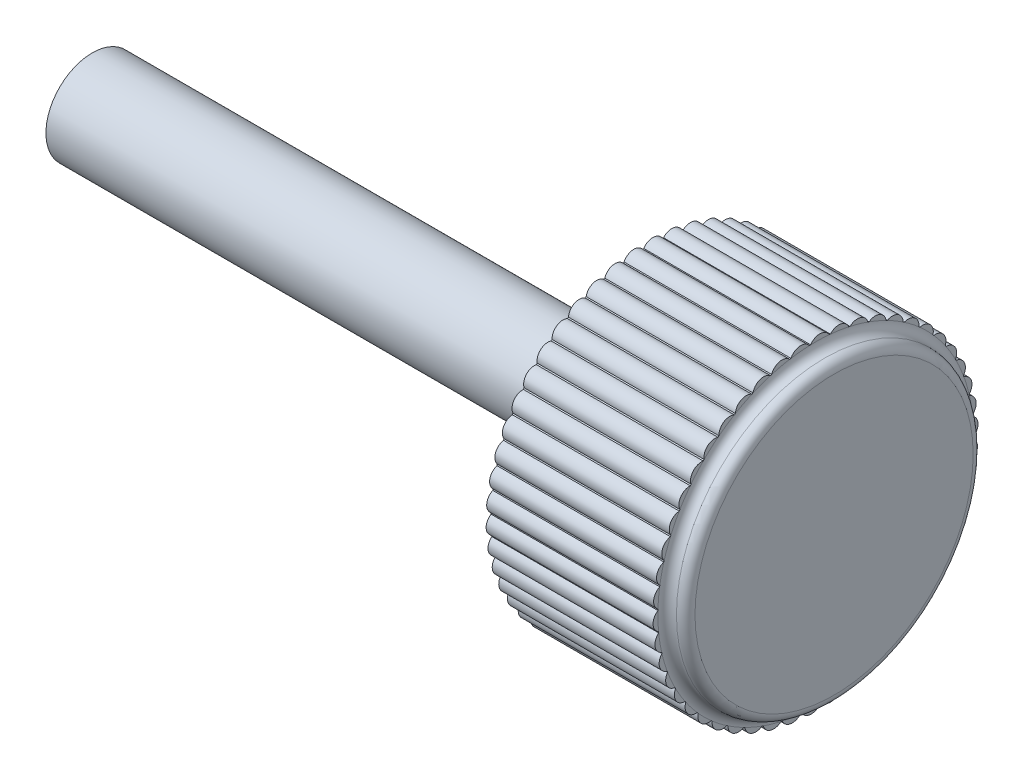
from build123d import *

# Parameters (mm, degrees)
SKETCH1_R      = 0.635
EXTRUDE1_DEPTH = 7.62
SKETCH2_R      = 2.032
EXTRUDE2_DEPTH = 2.54
EXTRUDE6_DEPTH = 2.286
FILLET2_R      = 0.127


with BuildPart() as part:
    # Sketch1 → Extrude1 (new body)
    with BuildSketch(Plane(origin=(0, 0, 0), x_dir=(0, 0, -1), z_dir=(1, 0, 0))):
        Circle(SKETCH1_R)
    extrude(amount=EXTRUDE1_DEPTH)

    # Sketch2 → Extrude2 (add)
    with BuildSketch(Plane(origin=(7.62, 0, 0), x_dir=(0, 0, -1), z_dir=(1, 0, 0))):
        Circle(SKETCH2_R)
    extrude(amount=EXTRUDE2_DEPTH)

    # Sketch3 → Extrude6 (add)
    with BuildSketch(Plane(origin=(9.906, 0, 0), x_dir=(0, 0, -1), z_dir=(1, 0, 0))):
        with BuildLine():
            ThreePointArc((-1.857711232, 1.100086351), (-1.862029707, 1.092760893), (-1.866319297, 1.085418482))
            ThreePointArc((-1.866319297, 1.085418482), (-1.987323102, 1.004182608), (-1.980940003, 0.858578886))
            ThreePointArc((-1.980940003, 0.858578886), (-1.984306303, 0.850769943), (-1.98764182, 0.842947801))
            ThreePointArc((-1.98764182, 0.842947801), (-2.097509919, 0.747186698), (-2.072928168, 0.603531119))
            ThreePointArc((-2.072928168, 0.603531119), (-2.075289203, 0.595361842), (-2.077618044, 0.587183329))
            ThreePointArc((-2.077618044, 0.587183329), (-2.174617752, 0.478407207), (-2.132225017, 0.338965306))
            ThreePointArc((-2.132225017, 0.338965306), (-2.133543553, 0.33056453), (-2.134828991, 0.322158626))
            ThreePointArc((-2.134828991, 0.322158626), (-2.217430563, 0.202082949), (-2.157895403, 0.069053807))
            ThreePointArc((-2.157895403, 0.069053807), (-2.158150646, 0.060554017), (-2.158372409, 0.052053288))
            ThreePointArc((-2.158372409, 0.052053288), (-2.22527317, -0.077428278), (-2.14953449, -0.201946712))
            ThreePointArc((-2.14953449, -0.201946712), (-2.148722414, -0.210411468), (-2.147877005, -0.218872961))
            ThreePointArc((-2.147877005, -0.218872961), (-2.19802189, -0.355718415), (-2.107274135, -0.46976241))
            ThreePointArc((-2.107274135, -0.46976241), (-2.105407547, -0.478058639), (-2.103508297, -0.486347452))
            ThreePointArc((-2.103508297, -0.486347452), (-2.136106492, -0.62839866), (-2.031780807, -0.730169674))
            ThreePointArc((-2.031780807, -0.730169674), (-2.028889144, -0.73816654), (-2.025966007, -0.746151954))
            ThreePointArc((-2.025966007, -0.746151954), (-2.040503418, -0.891168683), (-1.924245082, -0.979061727))
            ThreePointArc((-1.924245082, -0.979061727), (-1.920373948, -0.986633113), (-1.916473023, -0.994189194))
            ThreePointArc((-1.916473023, -0.994189194), (-1.912720387, -1.139884443), (-1.786362863, -1.212513391))
            ThreePointArc((-1.786362863, -1.212513391), (-1.781573307, -1.219539893), (-1.776756114, -1.226547476))
            ThreePointArc((-1.776756114, -1.226547476), (-1.754772612, -1.370623545), (-1.620308634, -1.426842994))
            ThreePointArc((-1.620308634, -1.426842994), (-1.614676191, -1.4332138), (-1.6090187, -1.439562372))
            ThreePointArc((-1.6090187, -1.439562372), (-1.569151025, -1.579747094), (-1.42870117, -1.618670432))
            ThreePointArc((-1.42870117, -1.618670432), (-1.422314667, -1.624285069), (-1.4159061, -1.629874509))
            ThreePointArc((-1.4159061, -1.629874509), (-1.358782989, -1.763957089), (-1.214562235, -1.784970469))
            ThreePointArc((-1.214562235, -1.784970469), (-1.207522392, -1.789740393), (-1.200463815, -1.794482552))
            ThreePointArc((-1.200463815, -1.794482552), (-1.126986133, -1.920348426), (-0.981268929, -1.923120456))
            ThreePointArc((-0.981268929, -1.923120456), (-0.973686766, -1.926970441), (-0.966089499, -1.930790533))
            ThreePointArc((-0.966089499, -1.930790533), (-0.877416033, -2.046454721), (-0.732500425, -2.030941685))
            ThreePointArc((-0.732500425, -2.030941685), (-0.724495519, -2.033811015), (-0.716479374, -2.036648793))
            ThreePointArc((-0.716479374, -2.036648793), (-0.614008558, -2.140287203), (-0.472179951, -2.10673375))
            ThreePointArc((-0.472179951, -2.10673375), (-0.463878544, -2.108577173), (-0.455569941, -2.110387886))
            ThreePointArc((-0.455569941, -2.110387886), (-0.340917802, -2.200366077), (-0.204412918, -2.149301365))
            ThreePointArc((-0.204412918, -2.149301365), (-0.195945928, -2.150089811), (-0.187475898, -2.150844901))
            ThreePointArc((-0.187475898, -2.150844901), (-0.062450567, -2.225743864), (0.066577829, -2.157973214))
            ThreePointArc((0.066577829, -2.157973214), (0.075076873, -2.157694247), (0.083574752, -2.157381807))
            ThreePointArc((0.083574752, -2.157381807), (0.21700155, -2.21602034), (0.336518603, -2.132612536))
            ThreePointArc((0.336518603, -2.132612536), (0.344915666, -2.131270556), (0.353307378, -2.129895513))
            ThreePointArc((0.353307378, -2.129895513), (0.493031422, -2.171348852), (0.601152279, -2.073619285))
            ThreePointArc((0.601152279, -2.073619285), (0.609314933, -2.071235455), (0.617468135, -2.068819495))
            ThreePointArc((0.617468135, -2.068819495), (0.761285895, -2.092433895), (0.856305424, -1.981923818))
            ThreePointArc((0.856305424, -1.981923818), (0.86410494, -1.978535734), (0.871891052, -1.975116957))
            ThreePointArc((0.871891052, -1.975116957), (1.017534435, -1.980520006), (1.09795412, -1.858972229))
            ThreePointArc((1.09795412, -1.858972229), (1.105267496, -1.854633323), (1.112563725, -1.850265645))
            ThreePointArc((1.112563725, -1.850265645), (1.257735848, -1.837372134), (1.322287425, -1.706703538))
            ThreePointArc((1.322287425, -1.706703538), (1.328999323, -1.701482236), (1.335690604, -1.696234539))
            ThreePointArc((1.335690604, -1.696234539), (1.478102016, -1.665247805), (1.525767467, -1.527519112))
            ThreePointArc((1.525767467, -1.527519112), (1.531772037, -1.521497758), (1.537752844, -1.5154528))
            ThreePointArc((1.537752844, -1.5154528), (1.675157632, -1.466861523), (1.705185244, -1.324244797))
            ThreePointArc((1.705185244, -1.324244797), (1.710387791, -1.317518351), (1.715563804, -1.310771466))
            ThreePointArc((1.715563804, -1.310771466), (1.845795012, -1.245341959), (1.857711232, -1.100086351))
            ThreePointArc((1.857711232, -1.100086351), (1.862029707, -1.092760893), (1.866319297, -1.085418482))
            ThreePointArc((1.866319297, -1.085418482), (1.987323102, -1.004182608), (1.980940003, -0.858578886))
            ThreePointArc((1.980940003, -0.858578886), (1.984306303, -0.850769943), (1.98764182, -0.842947801))
            ThreePointArc((1.98764182, -0.842947801), (2.097509919, -0.747186698), (2.072928168, -0.603531119))
            ThreePointArc((2.072928168, -0.603531119), (2.075289203, -0.595361842), (2.077618044, -0.587183329))
            ThreePointArc((2.077618044, -0.587183329), (2.174617752, -0.478407207), (2.132225017, -0.338965306))
            ThreePointArc((2.132225017, -0.338965306), (2.133543553, -0.33056453), (2.134828991, -0.322158626))
            ThreePointArc((2.134828991, -0.322158626), (2.217430563, -0.202082949), (2.157895403, -0.069053807))
            ThreePointArc((2.157895403, -0.069053807), (2.158150646, -0.060554017), (2.158372409, -0.052053288))
            ThreePointArc((2.158372409, -0.052053288), (2.22527317, 0.077428278), (2.14953449, 0.201946712))
            ThreePointArc((2.14953449, 0.201946712), (2.148722414, 0.210411468), (2.147877005, 0.218872961))
            ThreePointArc((2.147877005, 0.218872961), (2.19802189, 0.355718415), (2.107274135, 0.46976241))
            ThreePointArc((2.107274135, 0.46976241), (2.105407547, 0.478058639), (2.103508297, 0.486347452))
            ThreePointArc((2.103508297, 0.486347452), (2.136106492, 0.62839866), (2.031780807, 0.730169674))
            ThreePointArc((2.031780807, 0.730169674), (2.028889144, 0.73816654), (2.025966007, 0.746151954))
            ThreePointArc((2.025966007, 0.746151954), (2.040503418, 0.891168683), (1.924245082, 0.979061727))
            ThreePointArc((1.924245082, 0.979061727), (1.920373948, 0.986633113), (1.916473023, 0.994189194))
            ThreePointArc((1.916473023, 0.994189194), (1.912720387, 1.139884443), (1.786362863, 1.212513391))
            ThreePointArc((1.786362863, 1.212513391), (1.781573307, 1.219539893), (1.776756114, 1.226547476))
            ThreePointArc((1.776756114, 1.226547476), (1.754772612, 1.370623545), (1.620308634, 1.426842994))
            ThreePointArc((1.620308634, 1.426842994), (1.614676191, 1.4332138), (1.6090187, 1.439562372))
            ThreePointArc((1.6090187, 1.439562372), (1.569151025, 1.579747094), (1.42870117, 1.618670432))
            ThreePointArc((1.42870117, 1.618670432), (1.422314667, 1.624285069), (1.4159061, 1.629874509))
            ThreePointArc((1.4159061, 1.629874509), (1.358782989, 1.763957089), (1.214562235, 1.784970469))
            ThreePointArc((1.214562235, 1.784970469), (1.207522392, 1.789740393), (1.200463815, 1.794482552))
            ThreePointArc((1.200463815, 1.794482552), (1.126986133, 1.920348426), (0.981268929, 1.923120456))
            ThreePointArc((0.981268929, 1.923120456), (0.973686766, 1.926970441), (0.966089499, 1.930790533))
            ThreePointArc((0.966089499, 1.930790533), (0.877416033, 2.046454721), (0.732500425, 2.030941685))
            ThreePointArc((0.732500425, 2.030941685), (0.724495519, 2.033811015), (0.716479374, 2.036648793))
            ThreePointArc((0.716479374, 2.036648793), (0.614008558, 2.140287203), (0.472179951, 2.10673375))
            ThreePointArc((0.472179951, 2.10673375), (0.463878544, 2.108577173), (0.455569941, 2.110387886))
            ThreePointArc((0.455569941, 2.110387886), (0.340917802, 2.200366077), (0.204412918, 2.149301365))
            ThreePointArc((0.204412918, 2.149301365), (0.195945928, 2.150089811), (0.187475898, 2.150844901))
            ThreePointArc((0.187475898, 2.150844901), (0.062450567, 2.225743864), (-0.066577829, 2.157973214))
            ThreePointArc((-0.066577829, 2.157973214), (-0.075076873, 2.157694247), (-0.083574752, 2.157381807))
            ThreePointArc((-0.083574752, 2.157381807), (-0.21700155, 2.21602034), (-0.336518603, 2.132612536))
            ThreePointArc((-0.336518603, 2.132612536), (-0.344915666, 2.131270556), (-0.353307378, 2.129895513))
            ThreePointArc((-0.353307378, 2.129895513), (-0.493031422, 2.171348852), (-0.601152279, 2.073619285))
            ThreePointArc((-0.601152279, 2.073619285), (-0.609314933, 2.071235455), (-0.617468135, 2.068819495))
            ThreePointArc((-0.617468135, 2.068819495), (-0.761285895, 2.092433895), (-0.856305424, 1.981923818))
            ThreePointArc((-0.856305424, 1.981923818), (-0.86410494, 1.978535734), (-0.871891052, 1.975116957))
            ThreePointArc((-0.871891052, 1.975116957), (-1.017534435, 1.980520006), (-1.09795412, 1.858972229))
            ThreePointArc((-1.09795412, 1.858972229), (-1.105267496, 1.854633323), (-1.112563725, 1.850265645))
            ThreePointArc((-1.112563725, 1.850265645), (-1.257735848, 1.837372134), (-1.322287425, 1.706703538))
            ThreePointArc((-1.322287425, 1.706703538), (-1.328999323, 1.701482236), (-1.335690604, 1.696234539))
            ThreePointArc((-1.335690604, 1.696234539), (-1.478102016, 1.665247805), (-1.525767467, 1.527519112))
            ThreePointArc((-1.525767467, 1.527519112), (-1.531772037, 1.521497758), (-1.537752844, 1.5154528))
            ThreePointArc((-1.537752844, 1.5154528), (-1.675157632, 1.466861523), (-1.705185244, 1.324244797))
            ThreePointArc((-1.705185244, 1.324244797), (-1.710387791, 1.317518351), (-1.715563804, 1.310771466))
            ThreePointArc((-1.715563804, 1.310771466), (-1.845795012, 1.245341959), (-1.857711232, 1.100086351))
        make_face()
    extrude(amount=-EXTRUDE6_DEPTH)

    # Fillet2
    fillet2_edges = [part.edges().sort_by_distance(p)[0] for p in [
        (10.16, 0, 2.032),
        (9.906, 0, 2.032),
    ]]
    fillet(fillet2_edges, radius=FILLET2_R - 0.0001)  # a hair under: the kernel refuses the full size


solid = part.part
